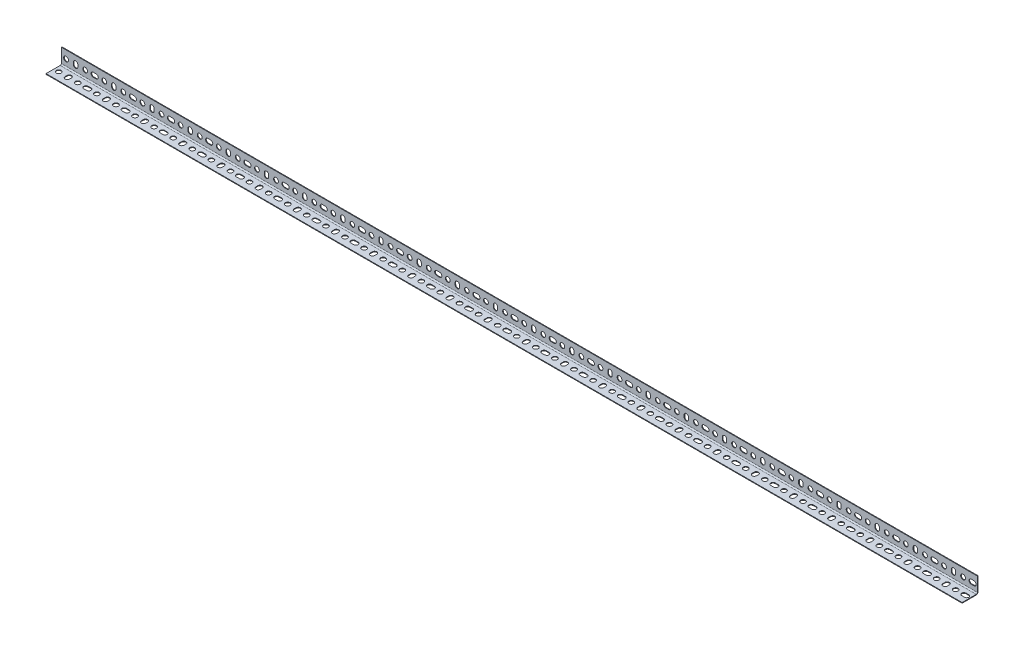
from build123d import *

# Parameters (mm, degrees)
BOSS_EXTRUDE1_DEPTH      = 914.4
SKETCH2_R                = 4.7879
CUT_EXTRUDE1_DEPTH       = 916.501766792
LPATTERN1_COUNT          = 24
LPATTERN1_PITCH          = 76.2
MIRROR1_COPY_1_SKETCH_R  = 4.7879
MIRROR1_COPY_1_DEPTH     = 916.501766792
MIRROR1_COPY_2_SKETCH_R  = 4.7879
MIRROR1_COPY_2_DEPTH     = 916.501766792
MIRROR1_COPY_3_SKETCH_R  = 4.7879
MIRROR1_COPY_3_DEPTH     = 916.501766792
MIRROR1_COPY_4_SKETCH_R  = 4.7879
MIRROR1_COPY_4_DEPTH     = 916.501766792
MIRROR1_COPY_5_SKETCH_R  = 4.7879
MIRROR1_COPY_5_DEPTH     = 916.501766792
MIRROR1_COPY_6_SKETCH_R  = 4.7879
MIRROR1_COPY_6_DEPTH     = 916.501766792
MIRROR1_COPY_7_SKETCH_R  = 4.7879
MIRROR1_COPY_7_DEPTH     = 916.501766792
MIRROR1_COPY_8_SKETCH_R  = 4.7879
MIRROR1_COPY_8_DEPTH     = 916.501766792
MIRROR1_COPY_9_SKETCH_R  = 4.7879
MIRROR1_COPY_9_DEPTH     = 916.501766792
MIRROR1_COPY_10_SKETCH_R = 4.7879
MIRROR1_COPY_10_DEPTH    = 916.501766792
MIRROR1_COPY_11_SKETCH_R = 4.7879
MIRROR1_COPY_11_DEPTH    = 916.501766792
MIRROR1_COPY_12_SKETCH_R = 4.7879
MIRROR1_COPY_12_DEPTH    = 916.501766792
MIRROR1_COPY_13_SKETCH_R = 4.7879
MIRROR1_COPY_13_DEPTH    = 916.501766792
MIRROR1_COPY_14_SKETCH_R = 4.7879
MIRROR1_COPY_14_DEPTH    = 916.501766792
MIRROR1_COPY_15_SKETCH_R = 4.7879
MIRROR1_COPY_15_DEPTH    = 916.501766792
MIRROR1_COPY_16_SKETCH_R = 4.7879
MIRROR1_COPY_16_DEPTH    = 916.501766792
MIRROR1_COPY_17_SKETCH_R = 4.7879
MIRROR1_COPY_17_DEPTH    = 916.501766792
MIRROR1_COPY_18_SKETCH_R = 4.7879
MIRROR1_COPY_18_DEPTH    = 916.501766792
MIRROR1_COPY_19_SKETCH_R = 4.7879
MIRROR1_COPY_19_DEPTH    = 916.501766792
MIRROR1_COPY_20_SKETCH_R = 4.7879
MIRROR1_COPY_20_DEPTH    = 916.501766792
MIRROR1_COPY_21_SKETCH_R = 4.7879
MIRROR1_COPY_21_DEPTH    = 916.501766792
MIRROR1_COPY_22_SKETCH_R = 4.7879
MIRROR1_COPY_22_DEPTH    = 916.501766792
MIRROR1_COPY_23_SKETCH_R = 4.7879
MIRROR1_COPY_23_DEPTH    = 916.501766792
MIRROR1_COPY_24_SKETCH_R = 4.7879
MIRROR1_COPY_24_DEPTH    = 916.501766792
FILLET1_R                = 2.4384
FILLET2_R                = 3.6576


with BuildPart() as part:
    # Sketch1 → Boss-Extrude1 (new, symmetric)
    with BuildSketch(Plane(origin=(0, 0, 0), x_dir=(0, 0, -1), z_dir=(1, 0, 0))):
        Polygon((-31.75, 1.2192), (-1.2192, 1.2192), (-1.2192, 31.75), (0, 31.75), (0, 0), (-31.75, 0), align=None)
    extrude(amount=BOSS_EXTRUDE1_DEPTH, both=True)

    # Sketch2 → Cut-Extrude1 (cut, through all)
    with BuildSketch(Plane.XY):
        with Locations((-904.875, 15.875)):
            Circle(SKETCH2_R)
        with Locations((-866.775, 15.875)):
            Circle(SKETCH2_R)
        with BuildLine():
            Line((-890.1938, 13.9065), (-890.1938, 17.8435))
            ThreePointArc((-890.1938, 17.8435), (-885.825, 22.2123), (-881.4562, 17.8435))
            Line((-881.4562, 17.8435), (-881.4562, 13.9065))
            ThreePointArc((-881.4562, 13.9065), (-885.825, 9.5377), (-890.1938, 13.9065))
        make_face()
        with BuildLine():
            Line((-850.4936, 20.2438), (-844.9564, 20.2438))
            ThreePointArc((-844.9564, 20.2438), (-840.5876, 15.875), (-844.9564, 11.5062))
            Line((-844.9564, 11.5062), (-850.4936, 11.5062))
            ThreePointArc((-850.4936, 11.5062), (-854.8624, 15.875), (-850.4936, 20.2438))
        make_face()
    cut_extrude1 = extrude(amount=CUT_EXTRUDE1_DEPTH, mode=Mode.SUBTRACT)

    # LPattern1: Cut-Extrude1 ×24
    with Locations(*[(i * LPATTERN1_PITCH, 0, 0) for i in range(1, LPATTERN1_COUNT)]):
        add(cut_extrude1, mode=Mode.SUBTRACT)

    # Mirror1 copy 1 sketch → Mirror1 copy 1 (cut, through all)
    with BuildSketch(Plane(origin=(76.2, 0, 0), x_dir=(1, 0, 0), z_dir=(0, 1, 0))):
        with Locations((-904.875, -15.875)):
            Circle(MIRROR1_COPY_1_SKETCH_R)
        with Locations((-866.775, -15.875)):
            Circle(MIRROR1_COPY_1_SKETCH_R)
        with BuildLine():
            Line((-890.1938, -13.9065), (-890.1938, -17.8435))
            ThreePointArc((-890.1938, -17.8435), (-885.825, -22.2123), (-881.4562, -17.8435))
            Line((-881.4562, -17.8435), (-881.4562, -13.9065))
            ThreePointArc((-881.4562, -13.9065), (-885.825, -9.5377), (-890.1938, -13.9065))
        make_face()
        with BuildLine():
            Line((-850.4936, -20.2438), (-844.9564, -20.2438))
            ThreePointArc((-844.9564, -20.2438), (-840.5876, -15.875), (-844.9564, -11.5062))
            Line((-844.9564, -11.5062), (-850.4936, -11.5062))
            ThreePointArc((-850.4936, -11.5062), (-854.8624, -15.875), (-850.4936, -20.2438))
        make_face()
    extrude(amount=MIRROR1_COPY_1_DEPTH, mode=Mode.SUBTRACT)

    # Mirror1 copy 2 sketch → Mirror1 copy 2 (cut, through all)
    with BuildSketch(Plane(origin=(152.4, 0, 0), x_dir=(1, 0, 0), z_dir=(0, 1, 0))):
        with Locations((-904.875, -15.875)):
            Circle(MIRROR1_COPY_2_SKETCH_R)
        with Locations((-866.775, -15.875)):
            Circle(MIRROR1_COPY_2_SKETCH_R)
        with BuildLine():
            Line((-890.1938, -13.9065), (-890.1938, -17.8435))
            ThreePointArc((-890.1938, -17.8435), (-885.825, -22.2123), (-881.4562, -17.8435))
            Line((-881.4562, -17.8435), (-881.4562, -13.9065))
            ThreePointArc((-881.4562, -13.9065), (-885.825, -9.5377), (-890.1938, -13.9065))
        make_face()
        with BuildLine():
            Line((-850.4936, -20.2438), (-844.9564, -20.2438))
            ThreePointArc((-844.9564, -20.2438), (-840.5876, -15.875), (-844.9564, -11.5062))
            Line((-844.9564, -11.5062), (-850.4936, -11.5062))
            ThreePointArc((-850.4936, -11.5062), (-854.8624, -15.875), (-850.4936, -20.2438))
        make_face()
    extrude(amount=MIRROR1_COPY_2_DEPTH, mode=Mode.SUBTRACT)

    # Mirror1 copy 3 sketch → Mirror1 copy 3 (cut, through all)
    with BuildSketch(Plane(origin=(228.6, 0, 0), x_dir=(1, 0, 0), z_dir=(0, 1, 0))):
        with Locations((-904.875, -15.875)):
            Circle(MIRROR1_COPY_3_SKETCH_R)
        with Locations((-866.775, -15.875)):
            Circle(MIRROR1_COPY_3_SKETCH_R)
        with BuildLine():
            Line((-890.1938, -13.9065), (-890.1938, -17.8435))
            ThreePointArc((-890.1938, -17.8435), (-885.825, -22.2123), (-881.4562, -17.8435))
            Line((-881.4562, -17.8435), (-881.4562, -13.9065))
            ThreePointArc((-881.4562, -13.9065), (-885.825, -9.5377), (-890.1938, -13.9065))
        make_face()
        with BuildLine():
            Line((-850.4936, -20.2438), (-844.9564, -20.2438))
            ThreePointArc((-844.9564, -20.2438), (-840.5876, -15.875), (-844.9564, -11.5062))
            Line((-844.9564, -11.5062), (-850.4936, -11.5062))
            ThreePointArc((-850.4936, -11.5062), (-854.8624, -15.875), (-850.4936, -20.2438))
        make_face()
    extrude(amount=MIRROR1_COPY_3_DEPTH, mode=Mode.SUBTRACT)

    # Mirror1 copy 4 sketch → Mirror1 copy 4 (cut, through all)
    with BuildSketch(Plane(origin=(304.8, 0, 0), x_dir=(1, 0, 0), z_dir=(0, 1, 0))):
        with Locations((-904.875, -15.875)):
            Circle(MIRROR1_COPY_4_SKETCH_R)
        with Locations((-866.775, -15.875)):
            Circle(MIRROR1_COPY_4_SKETCH_R)
        with BuildLine():
            Line((-890.1938, -13.9065), (-890.1938, -17.8435))
            ThreePointArc((-890.1938, -17.8435), (-885.825, -22.2123), (-881.4562, -17.8435))
            Line((-881.4562, -17.8435), (-881.4562, -13.9065))
            ThreePointArc((-881.4562, -13.9065), (-885.825, -9.5377), (-890.1938, -13.9065))
        make_face()
        with BuildLine():
            Line((-850.4936, -20.2438), (-844.9564, -20.2438))
            ThreePointArc((-844.9564, -20.2438), (-840.5876, -15.875), (-844.9564, -11.5062))
            Line((-844.9564, -11.5062), (-850.4936, -11.5062))
            ThreePointArc((-850.4936, -11.5062), (-854.8624, -15.875), (-850.4936, -20.2438))
        make_face()
    extrude(amount=MIRROR1_COPY_4_DEPTH, mode=Mode.SUBTRACT)

    # Mirror1 copy 5 sketch → Mirror1 copy 5 (cut, through all)
    with BuildSketch(Plane(origin=(381, 0, 0), x_dir=(1, 0, 0), z_dir=(0, 1, 0))):
        with Locations((-904.875, -15.875)):
            Circle(MIRROR1_COPY_5_SKETCH_R)
        with Locations((-866.775, -15.875)):
            Circle(MIRROR1_COPY_5_SKETCH_R)
        with BuildLine():
            Line((-890.1938, -13.9065), (-890.1938, -17.8435))
            ThreePointArc((-890.1938, -17.8435), (-885.825, -22.2123), (-881.4562, -17.8435))
            Line((-881.4562, -17.8435), (-881.4562, -13.9065))
            ThreePointArc((-881.4562, -13.9065), (-885.825, -9.5377), (-890.1938, -13.9065))
        make_face()
        with BuildLine():
            Line((-850.4936, -20.2438), (-844.9564, -20.2438))
            ThreePointArc((-844.9564, -20.2438), (-840.5876, -15.875), (-844.9564, -11.5062))
            Line((-844.9564, -11.5062), (-850.4936, -11.5062))
            ThreePointArc((-850.4936, -11.5062), (-854.8624, -15.875), (-850.4936, -20.2438))
        make_face()
    extrude(amount=MIRROR1_COPY_5_DEPTH, mode=Mode.SUBTRACT)

    # Mirror1 copy 6 sketch → Mirror1 copy 6 (cut, through all)
    with BuildSketch(Plane(origin=(457.2, 0, 0), x_dir=(1, 0, 0), z_dir=(0, 1, 0))):
        with Locations((-904.875, -15.875)):
            Circle(MIRROR1_COPY_6_SKETCH_R)
        with Locations((-866.775, -15.875)):
            Circle(MIRROR1_COPY_6_SKETCH_R)
        with BuildLine():
            Line((-890.1938, -13.9065), (-890.1938, -17.8435))
            ThreePointArc((-890.1938, -17.8435), (-885.825, -22.2123), (-881.4562, -17.8435))
            Line((-881.4562, -17.8435), (-881.4562, -13.9065))
            ThreePointArc((-881.4562, -13.9065), (-885.825, -9.5377), (-890.1938, -13.9065))
        make_face()
        with BuildLine():
            Line((-850.4936, -20.2438), (-844.9564, -20.2438))
            ThreePointArc((-844.9564, -20.2438), (-840.5876, -15.875), (-844.9564, -11.5062))
            Line((-844.9564, -11.5062), (-850.4936, -11.5062))
            ThreePointArc((-850.4936, -11.5062), (-854.8624, -15.875), (-850.4936, -20.2438))
        make_face()
    extrude(amount=MIRROR1_COPY_6_DEPTH, mode=Mode.SUBTRACT)

    # Mirror1 copy 7 sketch → Mirror1 copy 7 (cut, through all)
    with BuildSketch(Plane(origin=(533.4, 0, 0), x_dir=(1, 0, 0), z_dir=(0, 1, 0))):
        with Locations((-904.875, -15.875)):
            Circle(MIRROR1_COPY_7_SKETCH_R)
        with Locations((-866.775, -15.875)):
            Circle(MIRROR1_COPY_7_SKETCH_R)
        with BuildLine():
            Line((-890.1938, -13.9065), (-890.1938, -17.8435))
            ThreePointArc((-890.1938, -17.8435), (-885.825, -22.2123), (-881.4562, -17.8435))
            Line((-881.4562, -17.8435), (-881.4562, -13.9065))
            ThreePointArc((-881.4562, -13.9065), (-885.825, -9.5377), (-890.1938, -13.9065))
        make_face()
        with BuildLine():
            Line((-850.4936, -20.2438), (-844.9564, -20.2438))
            ThreePointArc((-844.9564, -20.2438), (-840.5876, -15.875), (-844.9564, -11.5062))
            Line((-844.9564, -11.5062), (-850.4936, -11.5062))
            ThreePointArc((-850.4936, -11.5062), (-854.8624, -15.875), (-850.4936, -20.2438))
        make_face()
    extrude(amount=MIRROR1_COPY_7_DEPTH, mode=Mode.SUBTRACT)

    # Mirror1 copy 8 sketch → Mirror1 copy 8 (cut, through all)
    with BuildSketch(Plane(origin=(609.6, 0, 0), x_dir=(1, 0, 0), z_dir=(0, 1, 0))):
        with Locations((-904.875, -15.875)):
            Circle(MIRROR1_COPY_8_SKETCH_R)
        with Locations((-866.775, -15.875)):
            Circle(MIRROR1_COPY_8_SKETCH_R)
        with BuildLine():
            Line((-890.1938, -13.9065), (-890.1938, -17.8435))
            ThreePointArc((-890.1938, -17.8435), (-885.825, -22.2123), (-881.4562, -17.8435))
            Line((-881.4562, -17.8435), (-881.4562, -13.9065))
            ThreePointArc((-881.4562, -13.9065), (-885.825, -9.5377), (-890.1938, -13.9065))
        make_face()
        with BuildLine():
            Line((-850.4936, -20.2438), (-844.9564, -20.2438))
            ThreePointArc((-844.9564, -20.2438), (-840.5876, -15.875), (-844.9564, -11.5062))
            Line((-844.9564, -11.5062), (-850.4936, -11.5062))
            ThreePointArc((-850.4936, -11.5062), (-854.8624, -15.875), (-850.4936, -20.2438))
        make_face()
    extrude(amount=MIRROR1_COPY_8_DEPTH, mode=Mode.SUBTRACT)

    # Mirror1 copy 9 sketch → Mirror1 copy 9 (cut, through all)
    with BuildSketch(Plane(origin=(685.8, 0, 0), x_dir=(1, 0, 0), z_dir=(0, 1, 0))):
        with Locations((-904.875, -15.875)):
            Circle(MIRROR1_COPY_9_SKETCH_R)
        with Locations((-866.775, -15.875)):
            Circle(MIRROR1_COPY_9_SKETCH_R)
        with BuildLine():
            Line((-890.1938, -13.9065), (-890.1938, -17.8435))
            ThreePointArc((-890.1938, -17.8435), (-885.825, -22.2123), (-881.4562, -17.8435))
            Line((-881.4562, -17.8435), (-881.4562, -13.9065))
            ThreePointArc((-881.4562, -13.9065), (-885.825, -9.5377), (-890.1938, -13.9065))
        make_face()
        with BuildLine():
            Line((-850.4936, -20.2438), (-844.9564, -20.2438))
            ThreePointArc((-844.9564, -20.2438), (-840.5876, -15.875), (-844.9564, -11.5062))
            Line((-844.9564, -11.5062), (-850.4936, -11.5062))
            ThreePointArc((-850.4936, -11.5062), (-854.8624, -15.875), (-850.4936, -20.2438))
        make_face()
    extrude(amount=MIRROR1_COPY_9_DEPTH, mode=Mode.SUBTRACT)

    # Mirror1 copy 10 sketch → Mirror1 copy 10 (cut, through all)
    with BuildSketch(Plane(origin=(762, 0, 0), x_dir=(1, 0, 0), z_dir=(0, 1, 0))):
        with Locations((-904.875, -15.875)):
            Circle(MIRROR1_COPY_10_SKETCH_R)
        with Locations((-866.775, -15.875)):
            Circle(MIRROR1_COPY_10_SKETCH_R)
        with BuildLine():
            Line((-890.1938, -13.9065), (-890.1938, -17.8435))
            ThreePointArc((-890.1938, -17.8435), (-885.825, -22.2123), (-881.4562, -17.8435))
            Line((-881.4562, -17.8435), (-881.4562, -13.9065))
            ThreePointArc((-881.4562, -13.9065), (-885.825, -9.5377), (-890.1938, -13.9065))
        make_face()
        with BuildLine():
            Line((-850.4936, -20.2438), (-844.9564, -20.2438))
            ThreePointArc((-844.9564, -20.2438), (-840.5876, -15.875), (-844.9564, -11.5062))
            Line((-844.9564, -11.5062), (-850.4936, -11.5062))
            ThreePointArc((-850.4936, -11.5062), (-854.8624, -15.875), (-850.4936, -20.2438))
        make_face()
    extrude(amount=MIRROR1_COPY_10_DEPTH, mode=Mode.SUBTRACT)

    # Mirror1 copy 11 sketch → Mirror1 copy 11 (cut, through all)
    with BuildSketch(Plane(origin=(838.2, 0, 0), x_dir=(1, 0, 0), z_dir=(0, 1, 0))):
        with Locations((-904.875, -15.875)):
            Circle(MIRROR1_COPY_11_SKETCH_R)
        with Locations((-866.775, -15.875)):
            Circle(MIRROR1_COPY_11_SKETCH_R)
        with BuildLine():
            Line((-890.1938, -13.9065), (-890.1938, -17.8435))
            ThreePointArc((-890.1938, -17.8435), (-885.825, -22.2123), (-881.4562, -17.8435))
            Line((-881.4562, -17.8435), (-881.4562, -13.9065))
            ThreePointArc((-881.4562, -13.9065), (-885.825, -9.5377), (-890.1938, -13.9065))
        make_face()
        with BuildLine():
            Line((-850.4936, -20.2438), (-844.9564, -20.2438))
            ThreePointArc((-844.9564, -20.2438), (-840.5876, -15.875), (-844.9564, -11.5062))
            Line((-844.9564, -11.5062), (-850.4936, -11.5062))
            ThreePointArc((-850.4936, -11.5062), (-854.8624, -15.875), (-850.4936, -20.2438))
        make_face()
    extrude(amount=MIRROR1_COPY_11_DEPTH, mode=Mode.SUBTRACT)

    # Mirror1 copy 12 sketch → Mirror1 copy 12 (cut, through all)
    with BuildSketch(Plane(origin=(914.4, 0, 0), x_dir=(1, 0, 0), z_dir=(0, 1, 0))):
        with Locations((-904.875, -15.875)):
            Circle(MIRROR1_COPY_12_SKETCH_R)
        with Locations((-866.775, -15.875)):
            Circle(MIRROR1_COPY_12_SKETCH_R)
        with BuildLine():
            Line((-890.1938, -13.9065), (-890.1938, -17.8435))
            ThreePointArc((-890.1938, -17.8435), (-885.825, -22.2123), (-881.4562, -17.8435))
            Line((-881.4562, -17.8435), (-881.4562, -13.9065))
            ThreePointArc((-881.4562, -13.9065), (-885.825, -9.5377), (-890.1938, -13.9065))
        make_face()
        with BuildLine():
            Line((-850.4936, -20.2438), (-844.9564, -20.2438))
            ThreePointArc((-844.9564, -20.2438), (-840.5876, -15.875), (-844.9564, -11.5062))
            Line((-844.9564, -11.5062), (-850.4936, -11.5062))
            ThreePointArc((-850.4936, -11.5062), (-854.8624, -15.875), (-850.4936, -20.2438))
        make_face()
    extrude(amount=MIRROR1_COPY_12_DEPTH, mode=Mode.SUBTRACT)

    # Mirror1 copy 13 sketch → Mirror1 copy 13 (cut, through all)
    with BuildSketch(Plane(origin=(990.6, 0, 0), x_dir=(1, 0, 0), z_dir=(0, 1, 0))):
        with Locations((-904.875, -15.875)):
            Circle(MIRROR1_COPY_13_SKETCH_R)
        with Locations((-866.775, -15.875)):
            Circle(MIRROR1_COPY_13_SKETCH_R)
        with BuildLine():
            Line((-890.1938, -13.9065), (-890.1938, -17.8435))
            ThreePointArc((-890.1938, -17.8435), (-885.825, -22.2123), (-881.4562, -17.8435))
            Line((-881.4562, -17.8435), (-881.4562, -13.9065))
            ThreePointArc((-881.4562, -13.9065), (-885.825, -9.5377), (-890.1938, -13.9065))
        make_face()
        with BuildLine():
            Line((-850.4936, -20.2438), (-844.9564, -20.2438))
            ThreePointArc((-844.9564, -20.2438), (-840.5876, -15.875), (-844.9564, -11.5062))
            Line((-844.9564, -11.5062), (-850.4936, -11.5062))
            ThreePointArc((-850.4936, -11.5062), (-854.8624, -15.875), (-850.4936, -20.2438))
        make_face()
    extrude(amount=MIRROR1_COPY_13_DEPTH, mode=Mode.SUBTRACT)

    # Mirror1 copy 14 sketch → Mirror1 copy 14 (cut, through all)
    with BuildSketch(Plane(origin=(1066.8, 0, 0), x_dir=(1, 0, 0), z_dir=(0, 1, 0))):
        with Locations((-904.875, -15.875)):
            Circle(MIRROR1_COPY_14_SKETCH_R)
        with Locations((-866.775, -15.875)):
            Circle(MIRROR1_COPY_14_SKETCH_R)
        with BuildLine():
            Line((-890.1938, -13.9065), (-890.1938, -17.8435))
            ThreePointArc((-890.1938, -17.8435), (-885.825, -22.2123), (-881.4562, -17.8435))
            Line((-881.4562, -17.8435), (-881.4562, -13.9065))
            ThreePointArc((-881.4562, -13.9065), (-885.825, -9.5377), (-890.1938, -13.9065))
        make_face()
        with BuildLine():
            Line((-850.4936, -20.2438), (-844.9564, -20.2438))
            ThreePointArc((-844.9564, -20.2438), (-840.5876, -15.875), (-844.9564, -11.5062))
            Line((-844.9564, -11.5062), (-850.4936, -11.5062))
            ThreePointArc((-850.4936, -11.5062), (-854.8624, -15.875), (-850.4936, -20.2438))
        make_face()
    extrude(amount=MIRROR1_COPY_14_DEPTH, mode=Mode.SUBTRACT)

    # Mirror1 copy 15 sketch → Mirror1 copy 15 (cut, through all)
    with BuildSketch(Plane(origin=(1143, 0, 0), x_dir=(1, 0, 0), z_dir=(0, 1, 0))):
        with Locations((-904.875, -15.875)):
            Circle(MIRROR1_COPY_15_SKETCH_R)
        with Locations((-866.775, -15.875)):
            Circle(MIRROR1_COPY_15_SKETCH_R)
        with BuildLine():
            Line((-890.1938, -13.9065), (-890.1938, -17.8435))
            ThreePointArc((-890.1938, -17.8435), (-885.825, -22.2123), (-881.4562, -17.8435))
            Line((-881.4562, -17.8435), (-881.4562, -13.9065))
            ThreePointArc((-881.4562, -13.9065), (-885.825, -9.5377), (-890.1938, -13.9065))
        make_face()
        with BuildLine():
            Line((-850.4936, -20.2438), (-844.9564, -20.2438))
            ThreePointArc((-844.9564, -20.2438), (-840.5876, -15.875), (-844.9564, -11.5062))
            Line((-844.9564, -11.5062), (-850.4936, -11.5062))
            ThreePointArc((-850.4936, -11.5062), (-854.8624, -15.875), (-850.4936, -20.2438))
        make_face()
    extrude(amount=MIRROR1_COPY_15_DEPTH, mode=Mode.SUBTRACT)

    # Mirror1 copy 16 sketch → Mirror1 copy 16 (cut, through all)
    with BuildSketch(Plane(origin=(1219.2, 0, 0), x_dir=(1, 0, 0), z_dir=(0, 1, 0))):
        with Locations((-904.875, -15.875)):
            Circle(MIRROR1_COPY_16_SKETCH_R)
        with Locations((-866.775, -15.875)):
            Circle(MIRROR1_COPY_16_SKETCH_R)
        with BuildLine():
            Line((-890.1938, -13.9065), (-890.1938, -17.8435))
            ThreePointArc((-890.1938, -17.8435), (-885.825, -22.2123), (-881.4562, -17.8435))
            Line((-881.4562, -17.8435), (-881.4562, -13.9065))
            ThreePointArc((-881.4562, -13.9065), (-885.825, -9.5377), (-890.1938, -13.9065))
        make_face()
        with BuildLine():
            Line((-850.4936, -20.2438), (-844.9564, -20.2438))
            ThreePointArc((-844.9564, -20.2438), (-840.5876, -15.875), (-844.9564, -11.5062))
            Line((-844.9564, -11.5062), (-850.4936, -11.5062))
            ThreePointArc((-850.4936, -11.5062), (-854.8624, -15.875), (-850.4936, -20.2438))
        make_face()
    extrude(amount=MIRROR1_COPY_16_DEPTH, mode=Mode.SUBTRACT)

    # Mirror1 copy 17 sketch → Mirror1 copy 17 (cut, through all)
    with BuildSketch(Plane(origin=(1295.4, 0, 0), x_dir=(1, 0, 0), z_dir=(0, 1, 0))):
        with Locations((-904.875, -15.875)):
            Circle(MIRROR1_COPY_17_SKETCH_R)
        with Locations((-866.775, -15.875)):
            Circle(MIRROR1_COPY_17_SKETCH_R)
        with BuildLine():
            Line((-890.1938, -13.9065), (-890.1938, -17.8435))
            ThreePointArc((-890.1938, -17.8435), (-885.825, -22.2123), (-881.4562, -17.8435))
            Line((-881.4562, -17.8435), (-881.4562, -13.9065))
            ThreePointArc((-881.4562, -13.9065), (-885.825, -9.5377), (-890.1938, -13.9065))
        make_face()
        with BuildLine():
            Line((-850.4936, -20.2438), (-844.9564, -20.2438))
            ThreePointArc((-844.9564, -20.2438), (-840.5876, -15.875), (-844.9564, -11.5062))
            Line((-844.9564, -11.5062), (-850.4936, -11.5062))
            ThreePointArc((-850.4936, -11.5062), (-854.8624, -15.875), (-850.4936, -20.2438))
        make_face()
    extrude(amount=MIRROR1_COPY_17_DEPTH, mode=Mode.SUBTRACT)

    # Mirror1 copy 18 sketch → Mirror1 copy 18 (cut, through all)
    with BuildSketch(Plane(origin=(1371.6, 0, 0), x_dir=(1, 0, 0), z_dir=(0, 1, 0))):
        with Locations((-904.875, -15.875)):
            Circle(MIRROR1_COPY_18_SKETCH_R)
        with Locations((-866.775, -15.875)):
            Circle(MIRROR1_COPY_18_SKETCH_R)
        with BuildLine():
            Line((-890.1938, -13.9065), (-890.1938, -17.8435))
            ThreePointArc((-890.1938, -17.8435), (-885.825, -22.2123), (-881.4562, -17.8435))
            Line((-881.4562, -17.8435), (-881.4562, -13.9065))
            ThreePointArc((-881.4562, -13.9065), (-885.825, -9.5377), (-890.1938, -13.9065))
        make_face()
        with BuildLine():
            Line((-850.4936, -20.2438), (-844.9564, -20.2438))
            ThreePointArc((-844.9564, -20.2438), (-840.5876, -15.875), (-844.9564, -11.5062))
            Line((-844.9564, -11.5062), (-850.4936, -11.5062))
            ThreePointArc((-850.4936, -11.5062), (-854.8624, -15.875), (-850.4936, -20.2438))
        make_face()
    extrude(amount=MIRROR1_COPY_18_DEPTH, mode=Mode.SUBTRACT)

    # Mirror1 copy 19 sketch → Mirror1 copy 19 (cut, through all)
    with BuildSketch(Plane(origin=(1447.8, 0, 0), x_dir=(1, 0, 0), z_dir=(0, 1, 0))):
        with Locations((-904.875, -15.875)):
            Circle(MIRROR1_COPY_19_SKETCH_R)
        with Locations((-866.775, -15.875)):
            Circle(MIRROR1_COPY_19_SKETCH_R)
        with BuildLine():
            Line((-890.1938, -13.9065), (-890.1938, -17.8435))
            ThreePointArc((-890.1938, -17.8435), (-885.825, -22.2123), (-881.4562, -17.8435))
            Line((-881.4562, -17.8435), (-881.4562, -13.9065))
            ThreePointArc((-881.4562, -13.9065), (-885.825, -9.5377), (-890.1938, -13.9065))
        make_face()
        with BuildLine():
            Line((-850.4936, -20.2438), (-844.9564, -20.2438))
            ThreePointArc((-844.9564, -20.2438), (-840.5876, -15.875), (-844.9564, -11.5062))
            Line((-844.9564, -11.5062), (-850.4936, -11.5062))
            ThreePointArc((-850.4936, -11.5062), (-854.8624, -15.875), (-850.4936, -20.2438))
        make_face()
    extrude(amount=MIRROR1_COPY_19_DEPTH, mode=Mode.SUBTRACT)

    # Mirror1 copy 20 sketch → Mirror1 copy 20 (cut, through all)
    with BuildSketch(Plane(origin=(1524, 0, 0), x_dir=(1, 0, 0), z_dir=(0, 1, 0))):
        with Locations((-904.875, -15.875)):
            Circle(MIRROR1_COPY_20_SKETCH_R)
        with Locations((-866.775, -15.875)):
            Circle(MIRROR1_COPY_20_SKETCH_R)
        with BuildLine():
            Line((-890.1938, -13.9065), (-890.1938, -17.8435))
            ThreePointArc((-890.1938, -17.8435), (-885.825, -22.2123), (-881.4562, -17.8435))
            Line((-881.4562, -17.8435), (-881.4562, -13.9065))
            ThreePointArc((-881.4562, -13.9065), (-885.825, -9.5377), (-890.1938, -13.9065))
        make_face()
        with BuildLine():
            Line((-850.4936, -20.2438), (-844.9564, -20.2438))
            ThreePointArc((-844.9564, -20.2438), (-840.5876, -15.875), (-844.9564, -11.5062))
            Line((-844.9564, -11.5062), (-850.4936, -11.5062))
            ThreePointArc((-850.4936, -11.5062), (-854.8624, -15.875), (-850.4936, -20.2438))
        make_face()
    extrude(amount=MIRROR1_COPY_20_DEPTH, mode=Mode.SUBTRACT)

    # Mirror1 copy 21 sketch → Mirror1 copy 21 (cut, through all)
    with BuildSketch(Plane(origin=(1600.2, 0, 0), x_dir=(1, 0, 0), z_dir=(0, 1, 0))):
        with Locations((-904.875, -15.875)):
            Circle(MIRROR1_COPY_21_SKETCH_R)
        with Locations((-866.775, -15.875)):
            Circle(MIRROR1_COPY_21_SKETCH_R)
        with BuildLine():
            Line((-890.1938, -13.9065), (-890.1938, -17.8435))
            ThreePointArc((-890.1938, -17.8435), (-885.825, -22.2123), (-881.4562, -17.8435))
            Line((-881.4562, -17.8435), (-881.4562, -13.9065))
            ThreePointArc((-881.4562, -13.9065), (-885.825, -9.5377), (-890.1938, -13.9065))
        make_face()
        with BuildLine():
            Line((-850.4936, -20.2438), (-844.9564, -20.2438))
            ThreePointArc((-844.9564, -20.2438), (-840.5876, -15.875), (-844.9564, -11.5062))
            Line((-844.9564, -11.5062), (-850.4936, -11.5062))
            ThreePointArc((-850.4936, -11.5062), (-854.8624, -15.875), (-850.4936, -20.2438))
        make_face()
    extrude(amount=MIRROR1_COPY_21_DEPTH, mode=Mode.SUBTRACT)

    # Mirror1 copy 22 sketch → Mirror1 copy 22 (cut, through all)
    with BuildSketch(Plane(origin=(1676.4, 0, 0), x_dir=(1, 0, 0), z_dir=(0, 1, 0))):
        with Locations((-904.875, -15.875)):
            Circle(MIRROR1_COPY_22_SKETCH_R)
        with Locations((-866.775, -15.875)):
            Circle(MIRROR1_COPY_22_SKETCH_R)
        with BuildLine():
            Line((-890.1938, -13.9065), (-890.1938, -17.8435))
            ThreePointArc((-890.1938, -17.8435), (-885.825, -22.2123), (-881.4562, -17.8435))
            Line((-881.4562, -17.8435), (-881.4562, -13.9065))
            ThreePointArc((-881.4562, -13.9065), (-885.825, -9.5377), (-890.1938, -13.9065))
        make_face()
        with BuildLine():
            Line((-850.4936, -20.2438), (-844.9564, -20.2438))
            ThreePointArc((-844.9564, -20.2438), (-840.5876, -15.875), (-844.9564, -11.5062))
            Line((-844.9564, -11.5062), (-850.4936, -11.5062))
            ThreePointArc((-850.4936, -11.5062), (-854.8624, -15.875), (-850.4936, -20.2438))
        make_face()
    extrude(amount=MIRROR1_COPY_22_DEPTH, mode=Mode.SUBTRACT)

    # Mirror1 copy 23 sketch → Mirror1 copy 23 (cut, through all)
    with BuildSketch(Plane(origin=(1752.6, 0, 0), x_dir=(1, 0, 0), z_dir=(0, 1, 0))):
        with Locations((-904.875, -15.875)):
            Circle(MIRROR1_COPY_23_SKETCH_R)
        with Locations((-866.775, -15.875)):
            Circle(MIRROR1_COPY_23_SKETCH_R)
        with BuildLine():
            Line((-890.1938, -13.9065), (-890.1938, -17.8435))
            ThreePointArc((-890.1938, -17.8435), (-885.825, -22.2123), (-881.4562, -17.8435))
            Line((-881.4562, -17.8435), (-881.4562, -13.9065))
            ThreePointArc((-881.4562, -13.9065), (-885.825, -9.5377), (-890.1938, -13.9065))
        make_face()
        with BuildLine():
            Line((-850.4936, -20.2438), (-844.9564, -20.2438))
            ThreePointArc((-844.9564, -20.2438), (-840.5876, -15.875), (-844.9564, -11.5062))
            Line((-844.9564, -11.5062), (-850.4936, -11.5062))
            ThreePointArc((-850.4936, -11.5062), (-854.8624, -15.875), (-850.4936, -20.2438))
        make_face()
    extrude(amount=MIRROR1_COPY_23_DEPTH, mode=Mode.SUBTRACT)

    # Mirror1 copy 24 sketch → Mirror1 copy 24 (cut, through all)
    with BuildSketch(Plane(origin=(0, 0, 0), x_dir=(1, 0, 0), z_dir=(0, 1, 0))):
        with Locations((-904.875, -15.875)):
            Circle(MIRROR1_COPY_24_SKETCH_R)
        with Locations((-866.775, -15.875)):
            Circle(MIRROR1_COPY_24_SKETCH_R)
        with BuildLine():
            Line((-890.1938, -13.9065), (-890.1938, -17.8435))
            ThreePointArc((-890.1938, -17.8435), (-885.825, -22.2123), (-881.4562, -17.8435))
            Line((-881.4562, -17.8435), (-881.4562, -13.9065))
            ThreePointArc((-881.4562, -13.9065), (-885.825, -9.5377), (-890.1938, -13.9065))
        make_face()
        with BuildLine():
            Line((-850.4936, -20.2438), (-844.9564, -20.2438))
            ThreePointArc((-844.9564, -20.2438), (-840.5876, -15.875), (-844.9564, -11.5062))
            Line((-844.9564, -11.5062), (-850.4936, -11.5062))
            ThreePointArc((-850.4936, -11.5062), (-854.8624, -15.875), (-850.4936, -20.2438))
        make_face()
    extrude(amount=MIRROR1_COPY_24_DEPTH, mode=Mode.SUBTRACT)

    # Fillet1
    fillet1_edges = [part.edges().sort_by_distance(p)[0] for p in [
        (0, 1.2192, 1.2192),
    ]]
    fillet(fillet1_edges, radius=FILLET1_R)

    # Fillet2
    fillet2_edges = [part.edges().sort_by_distance(p)[0] for p in [
        (0, 0, 0),
    ]]
    fillet(fillet2_edges, radius=FILLET2_R)


solid = part.part
